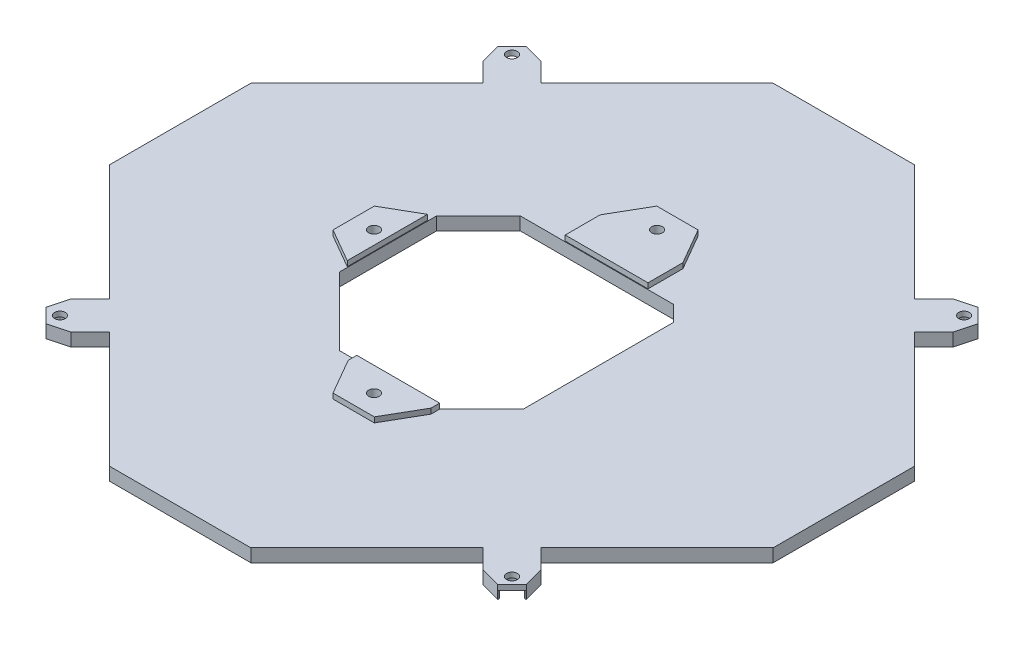
from build123d import *

# Parameters (mm, degrees)
BOSS_EXTRUDE1_DEPTH = 4.95
SKETCH2_R           = 2.05
CUT_EXTRUDE1_DEPTH  = 179.605969029
BOSS_EXTRUDE2_START = 2
SKETCH4_R           = 2.05
BOSS_EXTRUDE2_DEPTH = 2
SKETCH5_R           = 3.375
CUT_EXTRUDE2_DEPTH  = 3
FILLET1_R           = 1


with BuildPart() as part:
    # Sketch1 → Boss-Extrude1 (new body)
    with BuildSketch(Plane(origin=(0, -273.846152423, 0), x_dir=(-1, 0, 0), z_dir=(0, -1, 0))):
        Polygon((82.019978644, 71.058996872), (82.302821357, 71.341839584), (89.377289978, 78.416308206), (91.393147439, 85.939590671), (85.940417335, 91.392320775), (78.41713487, 89.376463314), (71.342666248, 82.301994692), (71.059823536, 82.01915198), (26.834314575, 126.244660941), (-26.834314575, 126.244660941), (-71.058996872, 82.019978644), (-71.341839584, 82.302821357), (-78.416308206, 89.377289978), (-85.939590671, 91.393147439), (-91.392320775, 85.940417335), (-89.376463314, 78.41713487), (-82.301994692, 71.342666248), (-82.01915198, 71.059823536), (-126.244660941, 26.834314575), (-126.244660941, -26.834315101), (-82.020078184, -71.059096411), (-82.302821357, -71.341839584), (-89.377289978, -78.416308206), (-91.393147439, -85.939590671), (-85.940417335, -91.392320775), (-78.41713487, -89.376463314), (-71.342666248, -82.301994692), (-71.059947679, -82.019276123), (-26.834124402, -126.245297959), (26.83450325, -126.245297959), (71.059226271, -82.020208043), (71.341839584, -82.302821357), (78.416308206, -89.377289978), (85.939590671, -91.393147439), (91.392320775, -85.940417335), (89.376463314, -78.41713487), (82.301994692, -71.342666248), (82.019335916, -71.060007472), (126.244660941, -26.834315547), (126.244660941, 26.834314575), align=None)
        Polygon((-33, -28.496194078), (-33, -5.25), (-33, 5.25), (-33, 28.496194078), (-27.096194078, 34.4), (31.270992349, 34.4), (47.174798271, 18.496194078), (47.174798271, -18.496194078), (21.270992349, -44.4), (-17.096194078, -44.4), align=None, mode=Mode.SUBTRACT)
    extrude(amount=-BOSS_EXTRUDE1_DEPTH)

    # Sketch2 → Cut-Extrude1 (cut, through all)
    with BuildSketch(Plane(origin=(0, -268.896152423, 0), x_dir=(1, 0, 0), z_dir=(0, 1, 0))):
        with Locations(Location((-86.015131958, 86.014305294, 0), (0, 0, 180))):
            Circle(SKETCH2_R)
        with Locations(Location((86.014305294, 86.015131958, 0), (0, 0, 180))):
            Circle(SKETCH2_R)
        with Locations(Location((86.014942311, -86.014942312, 0), (0, 0, 180))):
            Circle(SKETCH2_R)
        with Locations(Location((-86.015279607, -86.014897295, 0), (0, 0, 180))):
            Circle(SKETCH2_R)
        with Locations(Location((1.35, 53.85640646, 0), (0, 0, 180))):
            Circle(SKETCH2_R)
        with Locations(Location((-52.506406461, 0, 0), (0, 0, 180))):
            Circle(SKETCH2_R)
        with Locations(Location((1.35, -53.856406461, 0), (0, 0, 180))):
            Circle(SKETCH2_R)
    extrude(amount=-CUT_EXTRUDE1_DEPTH, mode=Mode.SUBTRACT)

    # Sketch4 → Boss-Extrude2 (add)
    # profile 1 of 3: a face of its own
    with BuildSketch(Plane(origin=(0, -268.896152423, 0), x_dir=(1, 0, 0), z_dir=(0, 1, 0)).offset(BOSS_EXTRUDE2_START)):
        Polygon((17.1, 47.933012702), (17.1, 34.65), (-14.4, 34.65), (-14.4, 47.933012702), (-6.505662433, 61.60640646), (9.205662433, 61.60640646), align=None)
        with Locations(Location((1.35, 53.85640646, 0), (0, 0, 180))):
            Circle(SKETCH4_R, mode=Mode.SUBTRACT)
    # profile 2 of 3: a face of its own
    with BuildSketch(Plane(origin=(0, -268.896152423, 0), x_dir=(1, 0, 0), z_dir=(0, 1, 0)).offset(BOSS_EXTRUDE2_START)):
        Polygon((-60.256406461, 7.855662432), (-60.256406461, -7.855662433), (-47.424798271, -15.263994875), (-47.424798271, 15.263994875), align=None)
        with Locations(Location((-52.506406461, 0, 0), (0, 0, 180))):
            Circle(SKETCH4_R, mode=Mode.SUBTRACT)
    # profile 3 of 3: a face of its own
    with BuildSketch(Plane(origin=(0, -268.896152423, 0), x_dir=(1, 0, 0), z_dir=(0, 1, 0)).offset(BOSS_EXTRUDE2_START)):
        Polygon((-14.4, -44.65), (17.1, -44.65), (17.1, -47.933012702), (9.205662433, -61.606406461), (-6.505662433, -61.606406461), (-14.4, -47.933012702), align=None)
        with Locations(Location((1.35, -53.856406461, 0), (0, 0, 180))):
            Circle(SKETCH4_R, mode=Mode.SUBTRACT)
    extrude(amount=-BOSS_EXTRUDE2_DEPTH)

    # Sketch5 → Cut-Extrude2 (cut)
    with BuildSketch(Plane.XZ.offset(273.846152423)):
        with Locations(Location((1.35, 53.856406461, 0), (0, 0, 270))):
            Circle(SKETCH5_R)
        with Locations(Location((-52.506406461, 0, 0), (0, 0, 270))):
            Circle(SKETCH5_R)
        with Locations(Location((1.35, -53.85640646, 0), (0, 0, 270))):
            Circle(SKETCH5_R)
        with BuildLine():
            Line((83.628456925, 88.401427698), (86.279883668, 91.052854442))
            Line((86.279883668, 91.052854442), (91.052854441, 86.279883669))
            Line((91.052854441, 86.279883669), (88.401427698, 83.628456925))
            ThreePointArc((88.401427698, 83.628456925), (83.628456925, 83.628456925), (83.628456925, 88.401427698))
        make_face()
        with BuildLine():
            Line((88.401427698, -83.628456925), (91.052854442, -86.279883668))
            Line((91.052854442, -86.279883668), (86.279883669, -91.052854441))
            Line((86.279883669, -91.052854441), (83.628456925, -88.401427698))
            ThreePointArc((83.628456925, -88.401427698), (83.628456925, -83.628456925), (88.401427698, -83.628456925))
        make_face()
        with BuildLine():
            Line((-83.628456925, -88.401427698), (-86.279883668, -91.052854442))
            Line((-86.279883668, -91.052854442), (-91.052854441, -86.279883669))
            Line((-91.052854441, -86.279883669), (-88.401427698, -83.628456925))
            ThreePointArc((-88.401427698, -83.628456925), (-83.628456925, -83.628456925), (-83.628456925, -88.401427698))
        make_face()
        with BuildLine():
            Line((-88.401427698, 83.628456925), (-91.052854442, 86.279883668))
            Line((-91.052854442, 86.279883668), (-86.279883669, 91.052854441))
            Line((-86.279883669, 91.052854441), (-83.628456925, 88.401427698))
            ThreePointArc((-83.628456925, 88.401427698), (-83.628456925, 83.628456925), (-88.401427698, 83.628456925))
        make_face()
    extrude(amount=-CUT_EXTRUDE2_DEPTH, mode=Mode.SUBTRACT)

    # Fillet1
    # the kernel refuses this fillet: 1 mm, written as the material it takes off along each edge
    with BuildSketch(Plane(origin=(86.279883669, -275.98346279, -91.052854441), x_dir=(-0.7071067811867247, 0, -0.7071067811863704), z_dir=(0, 1, 0)), Plane(origin=(-91.052854441, -275.98346279, -86.279883669), x_dir=(-0.7071067811863704, 0, 0.7071067811867247), z_dir=(0, 1, 0)), Plane(origin=(-86.279883669, -275.98346279, 91.052854441), x_dir=(0.7071067811867247, 0, 0.7071067811863703), z_dir=(0, 1, 0)), Plane(origin=(91.052854441, -275.98346279, 86.279883669), x_dir=(0.7071067811863703, 0, -0.7071067811867247), z_dir=(0, 1, 0))) as fillet1_piece_1:
        with BuildLine():
            CenterArc((1, 0.854924147), FILLET1_R, 180, 58.751355869)
            Line((0, 0.854924147), (-0.02, 0.854924147))
            Line((-0.02, 0.854924147), (-0.02, 0))
            Line((-0.02, 0), (0, -0.02))
            ThreePointArc((0, -0.02), (0.240623486, -0.02), (0.470871912, -0.017098483))
            Line((0.470871912, -0.017098483), (0.481246973, 0))
        make_face()
    extrude(amount=5.137310367, mode=Mode.SUBTRACT)
    with BuildSketch(Plane(origin=(91.052854442, -275.981686609, -86.279883668), x_dir=(0.7071067811864143, 0, 0.7071067811866807), z_dir=(0, 1, 0)), Plane(origin=(-86.279883668, -275.981686609, -91.052854442), x_dir=(0.7071067811866659, 0, -0.7071067811864291), z_dir=(0, 1, 0)), Plane(origin=(-91.052854442, -275.981686609, 86.279883668), x_dir=(-0.7071067811864143, 0, -0.7071067811866807), z_dir=(0, 1, 0)), Plane(origin=(86.279883668, -275.981686609, 91.052854442), x_dir=(-0.7071067811866807, 0, 0.7071067811864143), z_dir=(0, 1, 0))) as fillet1_piece_2:
        with BuildLine():
            CenterArc((1, -0.854213675), FILLET1_R, 121.327026771, 58.672973229)
            Line((0, -0.854213675), (-0.02, -0.854213675))
            Line((-0.02, -0.854213675), (-0.02, 0))
            Line((-0.02, 0), (0, 0.02))
            ThreePointArc((0, 0.02), (0.240038946, 0.02), (0.46967945, 0.017084273))
            Line((0.46967945, 0.017084273), (0.480077892, 0))
        make_face()
    extrude(amount=5.135534187, mode=Mode.SUBTRACT)


solid = part.part
